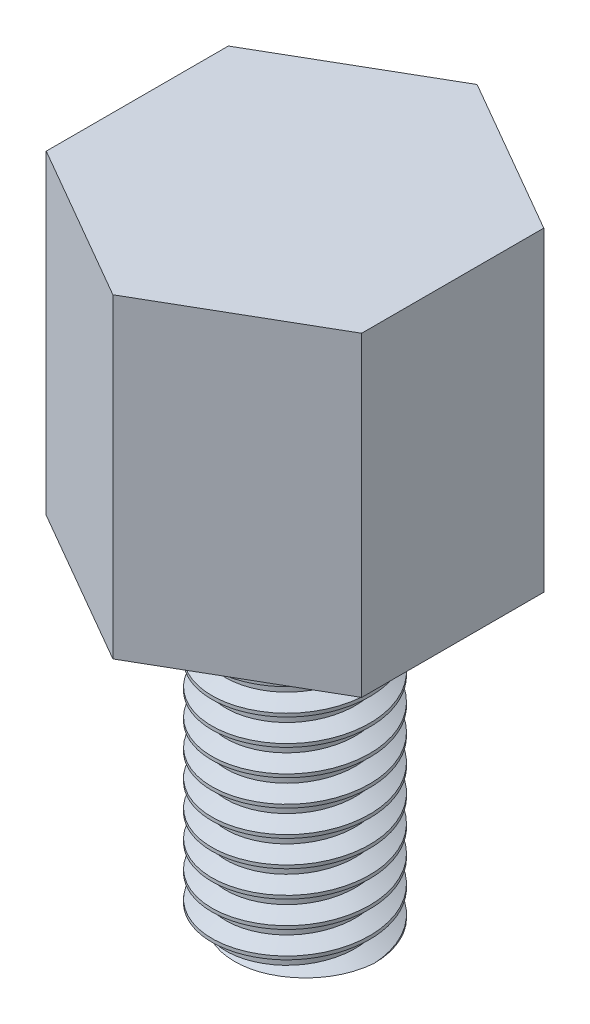
from build123d import *

# Parameters (mm, degrees)
BOSS_EXTRUDE1_DEPTH         = 25
SKETCH2_R                   = 1.5
BOSS_EXTRUDE2_DEPTH         = 6
TAP_DRILL_FOR_M3_TAP1_D     = 2.5
TAP_DRILL_FOR_M3_TAP1_DEPTH = 10
TAP_DRILL_FOR_M3_TAP1_TIP   = 0.751075774
THREAD1_PITCH               = 0.5
THREAD2_PITCH               = 0.5
SKETCH9_R                   = 11.225
SKETCH9_R_2                 = 1.225
CUT_EXTRUDE_THIN1_DEPTH     = 0.5
SKETCH_1_W                  = 12.579093551
SKETCH_1_H                  = 13.121588151
CUT_EXTRUDE_1_DEPTH         = 27


with BuildPart() as part:
    # Sketch1 → Boss-Extrude1 (new body)
    with BuildSketch(Plane(origin=(0, 0, 0), x_dir=(1, 0, 0), z_dir=(0, 1, 0))):
        Polygon((3, 1.732050808), (0, 3.464101615), (-3, 1.732050808), (-3, -1.732050808), (0, -3.464101615), (3, -1.732050808), align=None)
    extrude(amount=BOSS_EXTRUDE1_DEPTH)

    # Sketch2 → Boss-Extrude2 (add)
    with BuildSketch(Plane.XZ):
        with Locations(Location((0, 0, 0), (0, 0, 270))):
            Circle(SKETCH2_R)
    extrude(amount=BOSS_EXTRUDE2_DEPTH)

    # Tap Drill for M3 Tap1
    with Locations(Plane(origin=(0, 25, 0), x_dir=(1, 0, 0), z_dir=(0, 1, 0))):
        with Locations((0, 0)):
            Hole(TAP_DRILL_FOR_M3_TAP1_D / 2, depth=TAP_DRILL_FOR_M3_TAP1_DEPTH)
            with Locations((0, 0, -(TAP_DRILL_FOR_M3_TAP1_DEPTH + TAP_DRILL_FOR_M3_TAP1_TIP / 2))):  # 118° drill point
                Cone(0, TAP_DRILL_FOR_M3_TAP1_D / 2, TAP_DRILL_FOR_M3_TAP1_TIP, mode=Mode.SUBTRACT)

    # Thread1: the profile of Thread Profile1 profile screwed along a right-hand helix of 18 turns, 6 arcs to a turn; built about Z, then put on its axis
    thread1_z = Axis((0, 0, 0), (0, 0, 1))
    thread1_corners = [(1.2497, 0, -0.000173205), (1.520632937, 0, 0.156249999), (1.520632937, 0, 0.218749999), (1.2497, 0, 0.375173204)]
    with BuildLine(mode=Mode.PRIVATE) as thread1_profile:
        Line(thread1_corners[0], thread1_corners[1])
        Line(thread1_corners[1], thread1_corners[2])
        Line(thread1_corners[2], thread1_corners[3])
        Line(thread1_corners[3], thread1_corners[0])
    thread1_cap = Face(thread1_profile.wire())
    thread1_turn_angles = [0, 30, 60, 90, 120, 150, 180, 210, 240, 270, 300, 330, 360]
    thread1_turn_weights = [1, 0.8660254037844387, 1, 0.8660254037844387, 1, 0.8660254037844387, 1, 0.8660254037844387, 1, 0.8660254037844387, 1, 0.8660254037844387, 1]
    thread1_turn_rails = [Edge.make_bspline([Vector(p[0], p[1], 0).rotate(thread1_z, thread1_turn_angles[k]) / thread1_turn_weights[k] + Vector(0, 0, p[2] + THREAD1_PITCH * thread1_turn_angles[k] / 360) for k in range(13)], [0, 0, 0, 1, 1, 2, 2, 3, 3, 4, 4, 5, 5, 6, 6, 6], 2, thread1_turn_weights) for p in thread1_corners]
    thread1_turn_sides = [Face.make_surface_from_curves(thread1_turn_rails[p[0]], thread1_turn_rails[p[1]]) for p in [(0, 1), (1, 2), (2, 3), (3, 0)]]
    thread1 = Plane(origin=(0, 26, 0), x_dir=(-1, 0, 0), z_dir=(0, -1, 0)) * Solid(Shell([*[p.moved(Location((0, 0, THREAD1_PITCH * i))) for i in range(18) for p in thread1_turn_sides], thread1_cap, thread1_cap.rotate(thread1_z, 6480).moved(Location((0, 0, THREAD1_PITCH * 6480 / 360)))]))
    add(thread1, mode=Mode.SUBTRACT)

    # Thread2: the profile of Thread Profile2 profile screwed along a right-hand helix of 13 turns, 6 arcs to a turn; built about Z, then put on its axis
    thread2_z = Axis((0, 0, 0), (0, 0, 1))
    thread2_corners = [(1.5003, 0, -0.000173205), (1.5003, 0, 0.437673204), (1.229367063, 0, 0.281249999), (1.229367063, 0, 0.156249999)]
    with BuildLine(mode=Mode.PRIVATE) as thread2_profile:
        Line(thread2_corners[0], thread2_corners[1])
        Line(thread2_corners[1], thread2_corners[2])
        Line(thread2_corners[2], thread2_corners[3])
        Line(thread2_corners[3], thread2_corners[0])
    thread2_cap = Face(thread2_profile.wire())
    thread2_turn_angles = [0, 30, 60, 90, 120, 150, 180, 210, 240, 270, 300, 330, 360]
    thread2_turn_weights = [1, 0.8660254037844387, 1, 0.8660254037844387, 1, 0.8660254037844387, 1, 0.8660254037844387, 1, 0.8660254037844387, 1, 0.8660254037844387, 1]
    thread2_turn_rails = [Edge.make_bspline([Vector(p[0], p[1], 0).rotate(thread2_z, thread2_turn_angles[k]) / thread2_turn_weights[k] + Vector(0, 0, p[2] + THREAD2_PITCH * thread2_turn_angles[k] / 360) for k in range(13)], [0, 0, 0, 1, 1, 2, 2, 3, 3, 4, 4, 5, 5, 6, 6, 6], 2, thread2_turn_weights) for p in thread2_corners]
    thread2_turn_sides = [Face.make_surface_from_curves(thread2_turn_rails[p[0]], thread2_turn_rails[p[1]]) for p in [(0, 1), (1, 2), (2, 3), (3, 0)]]
    thread2 = Plane(origin=(0, -7, 0), x_dir=(1, 0, 0), z_dir=(0, 1, 0)) * Solid(Shell([*[p.moved(Location((0, 0, THREAD2_PITCH * i))) for i in range(13) for p in thread2_turn_sides], thread2_cap, thread2_cap.rotate(thread2_z, 4680).moved(Location((0, 0, THREAD2_PITCH * 4680 / 360)))]))
    add(thread2, mode=Mode.SUBTRACT)

    # Sketch9 → Cut-Extrude-Thin1 (cut)
    with BuildSketch(Plane(origin=(0, 0, 0), x_dir=(1, 0, 0), z_dir=(0, 1, 0))):
        Circle(SKETCH9_R)
        Circle(SKETCH9_R_2, mode=Mode.SUBTRACT)
    extrude(amount=-CUT_EXTRUDE_THIN1_DEPTH, mode=Mode.SUBTRACT)

    # 草图1 → 切除-拉伸1 (cut)
    with BuildSketch(Plane(origin=(0, 6, 0), x_dir=(-1, 0, 0), z_dir=(0, -1, 0))):
        with Locations((-0.926358339, -0.05426888)):
            Rectangle(SKETCH_1_W, SKETCH_1_H)
    extrude(amount=-CUT_EXTRUDE_1_DEPTH, mode=Mode.SUBTRACT)


solid = part.part
